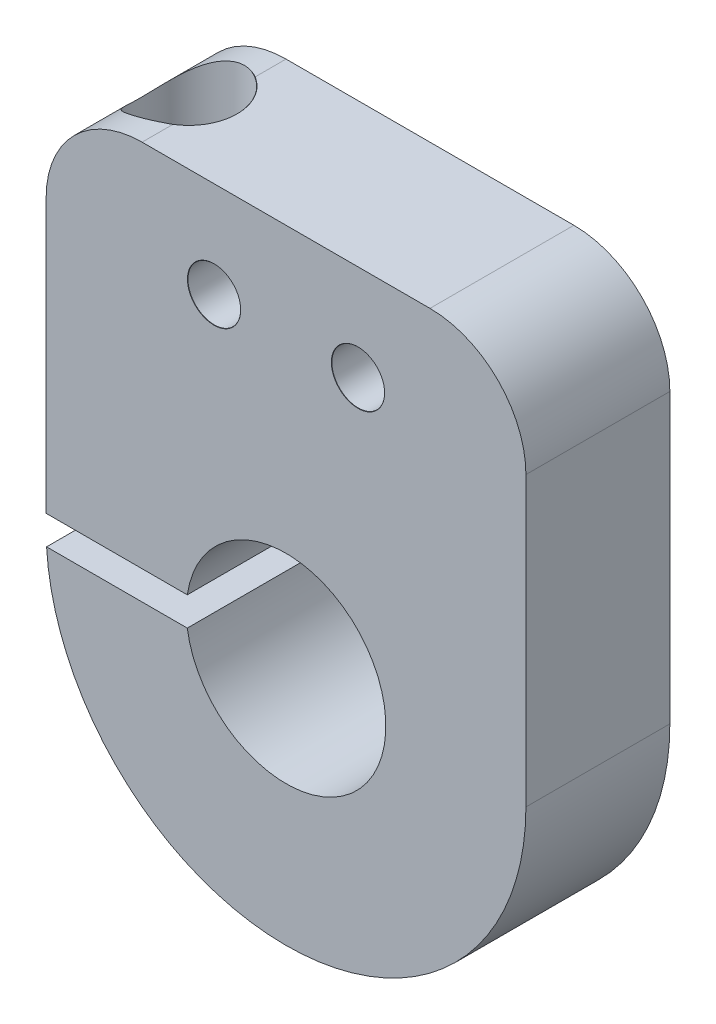
from build123d import *

# Parameters (mm, degrees)
BOSS_EXTRUDE1_DEPTH            = 15
SKETCH3_W                      = 14.708741574
SKETCH3_H                      = 3
CUT_EXTRUDE1_DEPTH             = 50.497474683
M5_CLEARANCE_HOLE1_D           = 5.5
M5_CLEARANCE_HOLE1_CSINK_D     = 5.55
M5_CLEARANCE_HOLE1_CSINK_ANGLE = 90
FILLET1_R                      = 10
CUT_EXTRUDE2_DEPTH             = 60.179810901


with BuildPart() as part:
    # Sketch2 → Boss-Extrude1 (new body)
    with BuildSketch(Plane.XY):
        with BuildLine():
            Line((-25, 40), (-25, 0))
            ThreePointArc((-25, 0), (0, 25), (25, 0))
            Line((25, 0), (25, 40))
            Line((25, 40), (-25, 40))
        make_face()
        with BuildLine():
            ThreePointArc((25, 0), (0, 25), (-25, 0))
            Line((-25, 0), (-10.4, 0))
            ThreePointArc((-10.4, 0), (0, 10.4), (10.4, 0))
            Line((10.4, 0), (25, 0))
        make_face()
        with BuildLine():
            Line((-10.4, 0), (-25, 0))
            ThreePointArc((-25, 0), (0, -25), (25, 0))
            Line((25, 0), (10.4, 0))
            ThreePointArc((10.4, 0), (0, -10.4), (-10.4, 0))
        make_face()
    extrude(amount=BOSS_EXTRUDE1_DEPTH)

    # Sketch3 → Cut-Extrude1 (cut, through all)
    with BuildSketch(Plane.XY.offset(15)):
        with Locations((-17.645629213, 0)):
            Rectangle(SKETCH3_W, SKETCH3_H)
    extrude(amount=-CUT_EXTRUDE1_DEPTH, mode=Mode.SUBTRACT)

    # Sketch10 → CBORE for M5 SHCS3 (revolve, cut)
    with BuildSketch(Plane(origin=(-17.623108927, 40, 7.5), x_dir=(0, 0, 1), z_dir=(1, 0, 0))):
        Polygon((0, 0), (0, 65), (2.75, 65), (2.75, 10), (5, 10), (5, 0.025), (5.025, 0), align=None)
    revolve(axis=Axis((-17.623108927, 46.35, 7.5), (0, -1, 0)), mode=Mode.SUBTRACT)

    # M5 Clearance Hole1 (through all)
    with Locations(Plane.XY.offset(15)):
        with Locations((-7.5, 30), (7.5, 30)):
            CounterSinkHole(M5_CLEARANCE_HOLE1_D / 2, M5_CLEARANCE_HOLE1_CSINK_D / 2, counter_sink_angle=M5_CLEARANCE_HOLE1_CSINK_ANGLE)

    # Fillet1
    # the kernel refuses this fillet: 10 mm, written as the material it takes off along each edge
    with BuildSketch(Plane(origin=(-25, 40, -25), x_dir=(0, -1, 0), z_dir=(0, 0, 1))) as fillet1_piece_1:
        with BuildLine():
            CenterArc((FILLET1_R, FILLET1_R), FILLET1_R, 180, 90)
            Line((0, FILLET1_R), (0, 0))
            Line((0, 0), (FILLET1_R, 0))
        make_face()
    extrude(amount=65, mode=Mode.SUBTRACT)
    with BuildSketch(Plane(origin=(25, 40, -25), x_dir=(0, -1, 0), z_dir=(0, 0, 1))) as fillet1_piece_2:
        with BuildLine():
            CenterArc((FILLET1_R, -FILLET1_R), FILLET1_R, 90, 90)
            Line((0, -FILLET1_R), (0, 0))
            Line((0, 0), (FILLET1_R, 0))
        make_face()
    extrude(amount=65, mode=Mode.SUBTRACT)

    # Sketch18 → Cut-Extrude2 (cut, through all)
    with BuildSketch(Plane(origin=(0, -11.5, 0), x_dir=(1, 0, 0), z_dir=(0, 1, 0))):
        Polygon((-19.99024503, -3.4), (-15.255972823, -3.4), (-12.888836719, -7.5), (-15.255972823, -11.6), (-19.99024503, -11.6), (-22.357381134, -7.5), align=None)
    extrude(amount=-CUT_EXTRUDE2_DEPTH, mode=Mode.SUBTRACT)


solid = part.part
